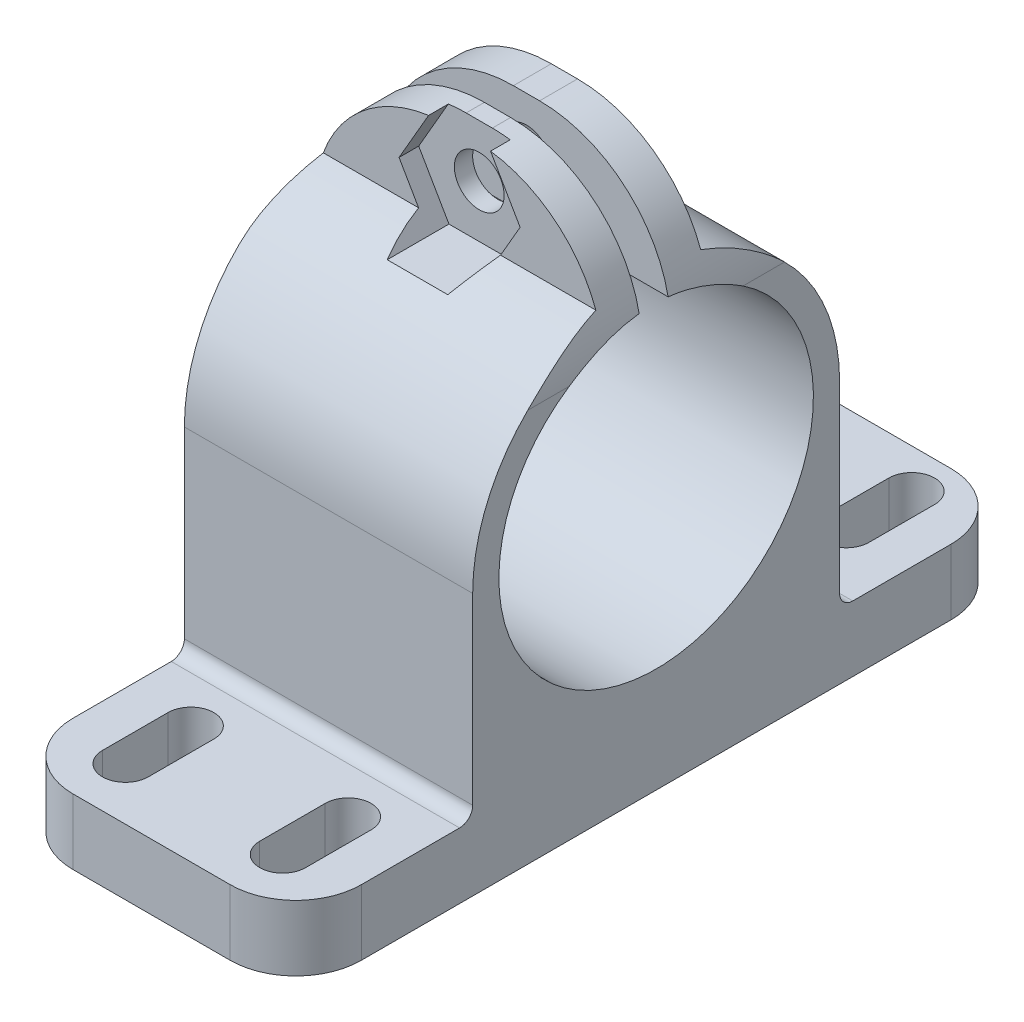
from build123d import *

# Parameters (mm, degrees)
SKETCH1_W             = 22
SKETCH1_H             = 55
BASE_DEPTH            = 5
SKETCH2_R             = 12
MOTOR_SUPPORT_DEPTH   = 22
SKETCH3_W             = 8
SKETCH3_H             = 8
CLAMP_FLANGE_DEPTH    = 22
SKETCH4_W             = 2.208433096
SKETCH4_H             = 15
SLOT_DEPTH            = 35
F_6_CLEARANCE_HOLE1_D = 3.7973
HEX_CUT_DEPTH         = 56.463952257
HEX_CUT_DEPTH_BACK    = 1.5
SKETCH9_R             = 3.5
SCREW_HEAD_CUT_DEPTH  = 56.463952257
MOUNTING_SLOT_DEPTH   = 50.651284016
LPATTERN1_COUNT       = 2
LPATTERN1_PITCH       = 12
LPATTERN1_COUNT_DIR2  = 2
LPATTERN1_PITCH_DIR2  = 43
FILLET2_R             = 5
FILLET3_R             = 1
FILLET4_R             = 10


with BuildPart() as part:
    # Sketch1 → Base (new body)
    with BuildSketch(Plane(origin=(0, 0, 0), x_dir=(1, 0, 0), z_dir=(0, 1, 0))):
        with Locations((-11, 0)):
            Rectangle(SKETCH1_W, SKETCH1_H)
    extrude(amount=BASE_DEPTH)

    # Sketch2 → Motor Support (add)
    with BuildSketch(Plane(origin=(0, 0, 0), x_dir=(0, 0, -1), z_dir=(1, 0, 0))):
        with BuildLine():
            Line((-14, 20), (-14, 0))
            Line((-14, 0), (14, 0))
            Line((14, 0), (14, 20))
            ThreePointArc((14, 20), (0, 34), (-14, 20))
        make_face()
        with Locations((0, 20)):
            Circle(SKETCH2_R, mode=Mode.SUBTRACT)
    extrude(amount=-MOTOR_SUPPORT_DEPTH)

    # Sketch3 → Clamp Flange (add)
    with BuildSketch(Plane(origin=(0, 0, 0), x_dir=(0, 0, -1), z_dir=(1, 0, 0))):
        with Locations((0, 36)):
            Rectangle(SKETCH3_W, SKETCH3_H)
    extrude(amount=-CLAMP_FLANGE_DEPTH)

    # Sketch4 → Slot (cut)
    with BuildSketch(Plane(origin=(0, 0, 0), x_dir=(0, 0, -1), z_dir=(1, 0, 0))):
        with Locations((0, 33.5)):
            Rectangle(SKETCH4_W, SKETCH4_H)
    extrude(amount=-SLOT_DEPTH, mode=Mode.SUBTRACT)

    # #6 Clearance Hole1 (through all)
    with Locations(Plane.XY.offset(4)):
        with Locations((-11, 36)):
            Hole(F_6_CLEARANCE_HOLE1_D / 2)

    # Sketch7 → Hex-Cut (cut, two sides: drawn at the far end of the back side and taken through both)
    with BuildSketch(Plane.XY.offset(4).offset(-HEX_CUT_DEPTH_BACK)):
        Polygon((-8.690598923, 40), (-13.309401077, 40), (-15.618802154, 36), (-13.309401077, 32), (-8.690598923, 32), (-6.381197846, 36), align=None)
    extrude(amount=HEX_CUT_DEPTH + HEX_CUT_DEPTH_BACK, mode=Mode.SUBTRACT)

    # Sketch9 → Screw Head Cut (cut, through all)
    with BuildSketch(Plane(origin=(0, 0, -4), x_dir=(-1, 0, 0), z_dir=(0, 0, -1))):
        with Locations((11, 36)):
            Circle(SKETCH9_R)
    extrude(amount=SCREW_HEAD_CUT_DEPTH, mode=Mode.SUBTRACT)

    # Sketch8 → Mounting Slot (cut, through all)
    with BuildSketch(Plane(origin=(0, 5, 0), x_dir=(1, 0, 0), z_dir=(0, 1, 0))):
        with BuildLine():
            Line((-18.75, 19.5), (-18.75, 24.5))
            ThreePointArc((-18.75, 24.5), (-17, 26.25), (-15.25, 24.5))
            Line((-15.25, 24.5), (-15.25, 19.5))
            ThreePointArc((-15.25, 19.5), (-17, 17.75), (-18.75, 19.5))
        make_face()
    mounting_slot = extrude(amount=-MOUNTING_SLOT_DEPTH, mode=Mode.SUBTRACT)

    # LPattern1: Mounting Slot 2 × 2
    with Locations(*[(i * LPATTERN1_PITCH, 0, j * LPATTERN1_PITCH_DIR2) for i in range(LPATTERN1_COUNT) for j in range(LPATTERN1_COUNT_DIR2) if (i, j) != (0, 0)]):
        add(mounting_slot, mode=Mode.SUBTRACT)

    # Fillet2
    fillet2_edges = [part.edges().sort_by_distance(p)[0] for p in [
        (0, 2.5, 27.5),
        (-22, 2.5, 27.5),
        (-22, 2.5, -27.5),
        (0, 2.5, -27.5),
    ]]
    fillet(fillet2_edges, radius=FILLET2_R)

    # Fillet3
    fillet3_edges = [part.edges().sort_by_distance(p)[0] for p in [
        (-11, 5, -14),
        (-11, 5, 14),
    ]]
    fillet(fillet3_edges, radius=FILLET3_R)

    # Fillet4
    # the kernel refuses this fillet: 10 mm, written as the material it takes off along each edge
    with BuildSketch(Plane(origin=(0, 40, -29), x_dir=(0, -1, 0), z_dir=(0, 0, 1)), Plane(origin=(0, 40, -23.895783452), x_dir=(0, -1, 0), z_dir=(0, 0, 1))) as fillet4_piece_1:
        with BuildLine():
            CenterArc((FILLET4_R, -FILLET4_R), FILLET4_R, 90, 90)
            Line((0, -FILLET4_R), (0, 0))
            Line((0, 0), (FILLET4_R, 0))
        make_face()
    extrude(amount=52.895783452, mode=Mode.SUBTRACT)
    with BuildSketch(Plane(origin=(-22, 40, -29), x_dir=(0, -1, 0), z_dir=(0, 0, 1)), Plane(origin=(-22, 40, -23.895783452), x_dir=(0, -1, 0), z_dir=(0, 0, 1))) as fillet4_piece_2:
        with BuildLine():
            CenterArc((FILLET4_R, FILLET4_R), FILLET4_R, 180, 90)
            Line((0, FILLET4_R), (0, 0))
            Line((0, 0), (FILLET4_R, 0))
        make_face()
    extrude(amount=52.895783452, mode=Mode.SUBTRACT)


solid = part.part
